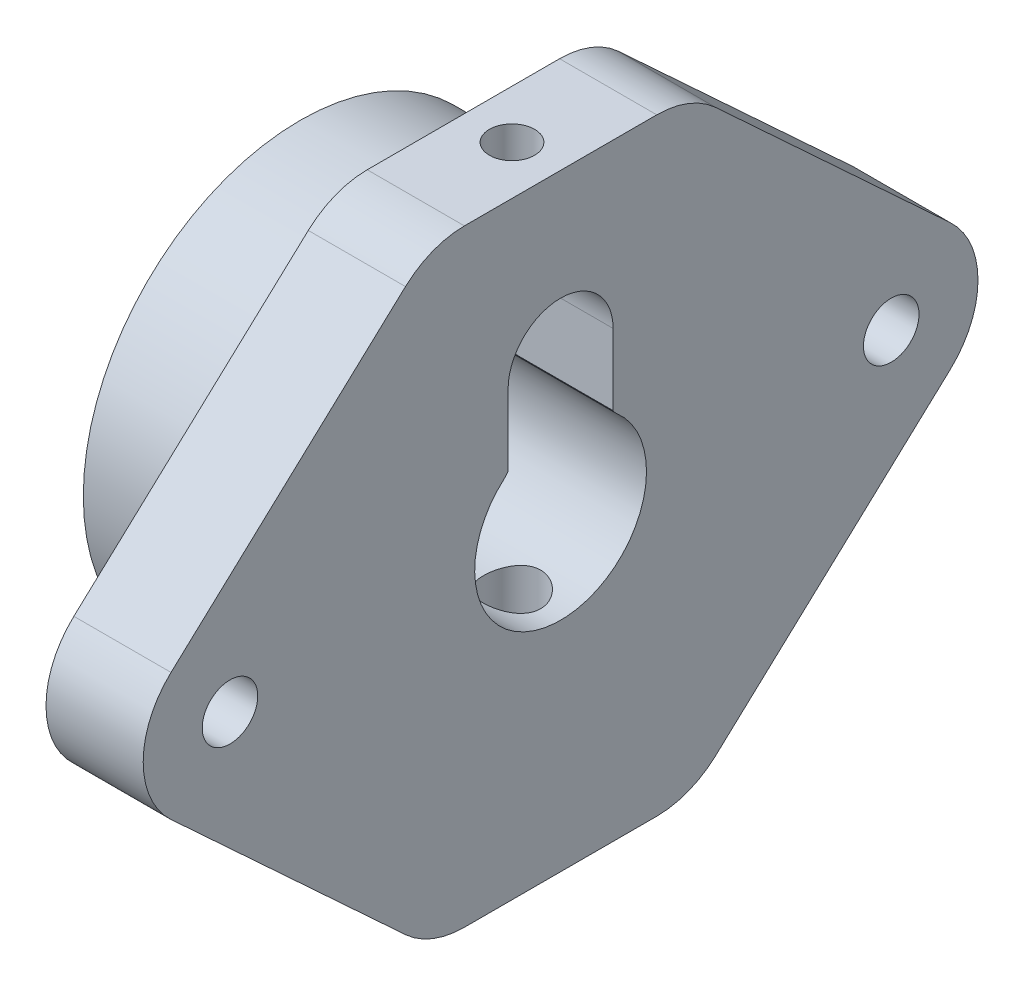
from build123d import *

# Parameters (mm, degrees)
SKETCH_1_R          = 12.5
EXTRUDE_1_DEPTH     = 15
SKETCH_2_R          = 25
EXTRUDE_2_DEPTH     = 5.6
SKETCH_3_R          = 4.95
CUT_EXTRUDE_1_DEPTH = 39.405728739
CUT_EXTRUDE_2_DEPTH = 39.405728739
SKETCH_5_R          = 1.3
CUT_EXTRUDE_3_DEPTH = 46.552167896
SKETCH_6_R          = 1.6
CUT_EXTRUDE_4_DEPTH = 35.003676367
EXTRUDE_START       = 0.5
SKETCH_7_R          = 13.5
SKETCH_7_R_2        = 12.5
EXTRUDE_3_DEPTH     = 0.5
CUT_EXTRUDE_6_DEPTH = 35.003676367
CUT_EXTRUDE_7_DEPTH = 15
FILLET_3_R          = 5
FILLET_4_R          = 1
CUT_EXTRUDE_START   = -15
SKETCH_11_R         = 1.65
SKETCH_11_R_2       = 1.3
CUT_EXTRUDE_8_DEPTH = 15


with BuildPart() as part:
    # ｽｹｯﾁ1 → ﾎﾞｽ - 押し出し1 (new body)
    with BuildSketch(Plane(origin=(0, 0, 0), x_dir=(0, 0, -1), z_dir=(1, 0, 0))):
        Circle(SKETCH_1_R)
    extrude(amount=EXTRUDE_1_DEPTH)

    # ｽｹｯﾁ2 → ﾎﾞｽ - 押し出し2 (add)
    with BuildSketch(Plane(origin=(15, 0, 0), x_dir=(0, 0, -1), z_dir=(1, 0, 0))):
        Circle(SKETCH_2_R)
    extrude(amount=-EXTRUDE_2_DEPTH)

    # ｽｹｯﾁ3 → ｶｯﾄ - 押し出し1 (cut, through all)
    with BuildSketch(Plane(origin=(15, 0, 0), x_dir=(0, 0, -1), z_dir=(1, 0, 0))):
        Circle(SKETCH_3_R)
    extrude(amount=-CUT_EXTRUDE_1_DEPTH, mode=Mode.SUBTRACT)

    # ｽｹｯﾁ4 → ｶｯﾄ - 押し出し2 (cut, through all)
    with BuildSketch(Plane(origin=(15, 0, 0), x_dir=(0, 0, -1), z_dir=(1, 0, 0))):
        with BuildLine():
            Line((-17.853571071, 17.5), (17.853571071, 17.5))
            ThreePointArc((17.853571071, 17.5), (0, 25), (-17.853571071, 17.5))
        make_face()
        with BuildLine():
            Line((17.853571071, -17.5), (-17.853571071, -17.5))
            ThreePointArc((-17.853571071, -17.5), (0, -25), (17.853571071, -17.5))
        make_face()
    extrude(amount=-CUT_EXTRUDE_2_DEPTH, mode=Mode.SUBTRACT)

    # ｽｹｯﾁ5 → ｶｯﾄ - 押し出し3 (cut, through all)
    with BuildSketch(Plane(origin=(0, 17.5, 0), x_dir=(1, 0, 0), z_dir=(0, 1, 0))):
        with Locations(Location((12.2, 0, 0), (0, 0, 270))):
            Circle(SKETCH_5_R)
    extrude(amount=-CUT_EXTRUDE_3_DEPTH, mode=Mode.SUBTRACT)

    # ｽｹｯﾁ6 → ｶｯﾄ - 押し出し4 (cut, through all)
    with BuildSketch(Plane(origin=(15, 0, 0), x_dir=(0, 0, -1), z_dir=(1, 0, 0))):
        with Locations((-19.05, 0)):
            Circle(SKETCH_6_R)
        with Locations((19.05, 0)):
            Circle(SKETCH_6_R)
    extrude(amount=-CUT_EXTRUDE_4_DEPTH, mode=Mode.SUBTRACT)

    # ｽｹｯﾁ7 → ﾎﾞｽ - 押し出し3 (add)
    with BuildSketch(Plane.ZY.offset(-9.4).offset(EXTRUDE_START)):
        with Locations(Location((0, 0, 0), (0, 0, 180))):
            Circle(SKETCH_7_R)
        Circle(SKETCH_7_R_2, mode=Mode.SUBTRACT)
    extrude(amount=-EXTRUDE_3_DEPTH)

    # ｽｹｯﾁ9 → ｶｯﾄ - 押し出し6 (cut, through all)
    with BuildSketch(Plane(origin=(15, 0, 0), x_dir=(0, 0, -1), z_dir=(1, 0, 0))):
        with BuildLine():
            Line((-17.853571071, -17.5), (-7.5, -17.5))
            Line((-7.5, -17.5), (-22.445895783, -3.669862645))
            ThreePointArc((-22.445895783, -3.669862645), (-24.05, 0), (-22.445895783, 3.669862645))
            Line((-22.445895783, 3.669862645), (-7.5, 17.5))
            Line((-7.5, 17.5), (-17.853571071, 17.5))
            ThreePointArc((-17.853571071, 17.5), (-25, 0), (-17.853571071, -17.5))
        make_face()
        with BuildLine():
            Line((22.445895783, -3.669862645), (7.5, -17.5))
            Line((7.5, -17.5), (17.853571071, -17.5))
            ThreePointArc((17.853571071, -17.5), (25, 0), (17.853571071, 17.5))
            Line((17.853571071, 17.5), (7.5, 17.5))
            Line((7.5, 17.5), (22.445895783, 3.669862645))
            ThreePointArc((22.445895783, 3.669862645), (23.631456041, 2.002563493), (24.05, 0))
            ThreePointArc((24.05, 0), (23.631456041, -2.002563493), (22.445895783, -3.669862645))
        make_face()
    extrude(amount=-CUT_EXTRUDE_6_DEPTH, mode=Mode.SUBTRACT)

    # ｽｹｯﾁ10 → ｶｯﾄ - 押し出し7 (cut)
    with BuildSketch(Plane(origin=(15, 0, 0), x_dir=(0, 0, -1), z_dir=(1, 0, 0))):
        with BuildLine():
            Line((-3.025, 4), (3.025, 4))
            Line((3.025, 4), (3.025, 8.1))
            ThreePointArc((3.025, 8.1), (0, 11.125), (-3.025, 8.1))
            Line((-3.025, 8.1), (-3.025, 4))
        make_face()
    extrude(amount=-CUT_EXTRUDE_7_DEPTH, mode=Mode.SUBTRACT)

    # ﾌｨﾚｯﾄ3
    fillet_3_edges = [part.edges().sort_by_distance(p)[0] for p in [
        (12.2, 17.5, -7.5),
        (12.2, 17.5, 7.5),
        (12.2, -17.5, -7.5),
        (12.2, -17.5, 7.5),
    ]]
    fillet(fillet_3_edges, radius=FILLET_3_R)

    # ﾌｨﾚｯﾄ4
    # the kernel refuses this fillet: 1 mm, written as the material it takes off along each edge
    with BuildSketch(Plane(origin=(-1.021064618, 4, -2.915904662), x_dir=(0, 0, -1), z_dir=(1, 0, 0))) as fillet_4_piece_1:
        with BuildLine():
            CenterArc((0.973519116, 0.502763893), FILLET_4_R, 210.183026769, 18.996983583)
            ThreePointArc((0.319834447, -0.254003148), (0.162538073, -0.123701466), (0, 0))
            Line((0, 0), (0.109095338, 0))
        make_face()
    extrude(amount=17.042129236, mode=Mode.SUBTRACT)
    with BuildSketch(Plane(origin=(-1.021064618, 4, 2.915904662), x_dir=(0, -0.6219076232643732, 0.783090612972508), z_dir=(1, 0, 0))) as fillet_4_piece_2:
        with BuildLine():
            CenterArc((0.449680983, -0.999148644), FILLET_4_R, 92.364416205, 18.996983583)
            Line((0.085431535, -0.067847222), (0, 0))
            ThreePointArc((0, 0), (0.204212924, -0.00421421), (0.408425847, 0))
        make_face()
    extrude(amount=17.042129236, mode=Mode.SUBTRACT)

    # ｽｹｯﾁ11 → ｶｯﾄ - 押し出し8 (cut)
    with BuildSketch(Plane.XZ.offset(17.5).offset(CUT_EXTRUDE_START)):
        with Locations(Location((12.2, 0, 0), (0, 0, 270))):
            Circle(SKETCH_11_R)
        with Locations(Location((12.2, 0, 0), (0, 0, 90))):
            Circle(SKETCH_11_R_2, mode=Mode.SUBTRACT)
    extrude(amount=CUT_EXTRUDE_8_DEPTH, mode=Mode.SUBTRACT)


solid = part.part
